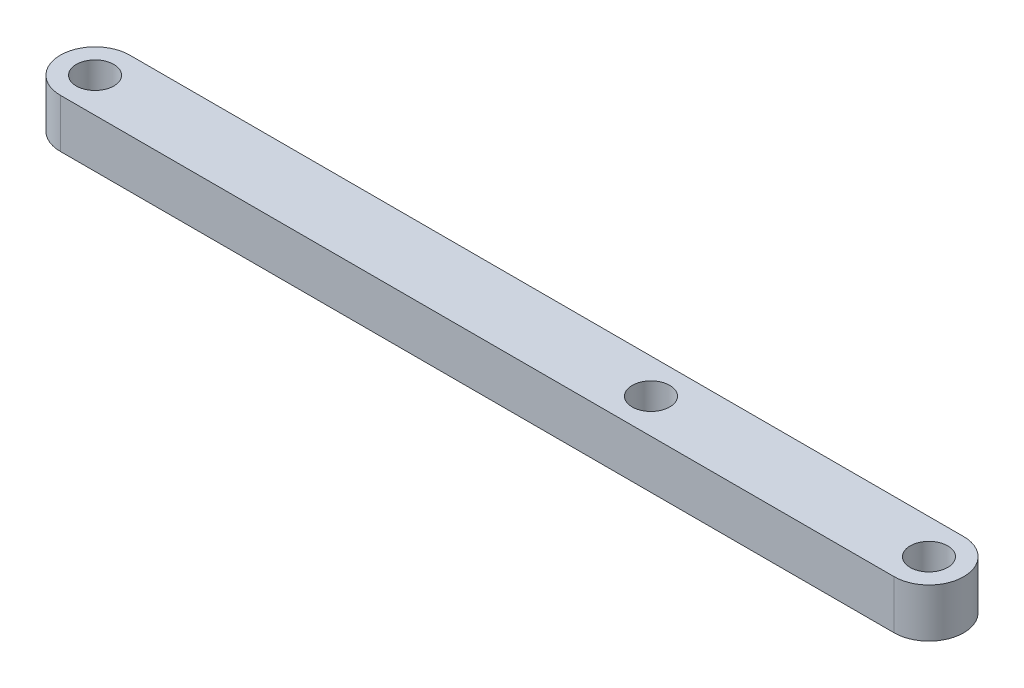
from build123d import *

# Parameters (mm, degrees)
SKETCH1_R           = 2.7
BOSS_EXTRUDE1_DEPTH = 7


with BuildPart() as part:
    # Sketch1 → Boss-Extrude1 (new body)
    with BuildSketch(Plane(origin=(0, 0, 0), x_dir=(1, 0, 0), z_dir=(0, 1, 0))):
        with BuildLine():
            Line((-60, -5), (60, -5))
            ThreePointArc((60, -5), (65, 0), (60, 5))
            Line((60, 5), (-60, 5))
            ThreePointArc((-60, 5), (-65, 0), (-60, -5))
        make_face()
        with Locations((-60, 0)):
            Circle(SKETCH1_R, mode=Mode.SUBTRACT)
        with Locations((60, 0)):
            Circle(SKETCH1_R, mode=Mode.SUBTRACT)
        with Locations((20, 0)):
            Circle(SKETCH1_R, mode=Mode.SUBTRACT)
    extrude(amount=BOSS_EXTRUDE1_DEPTH)


solid = part.part
